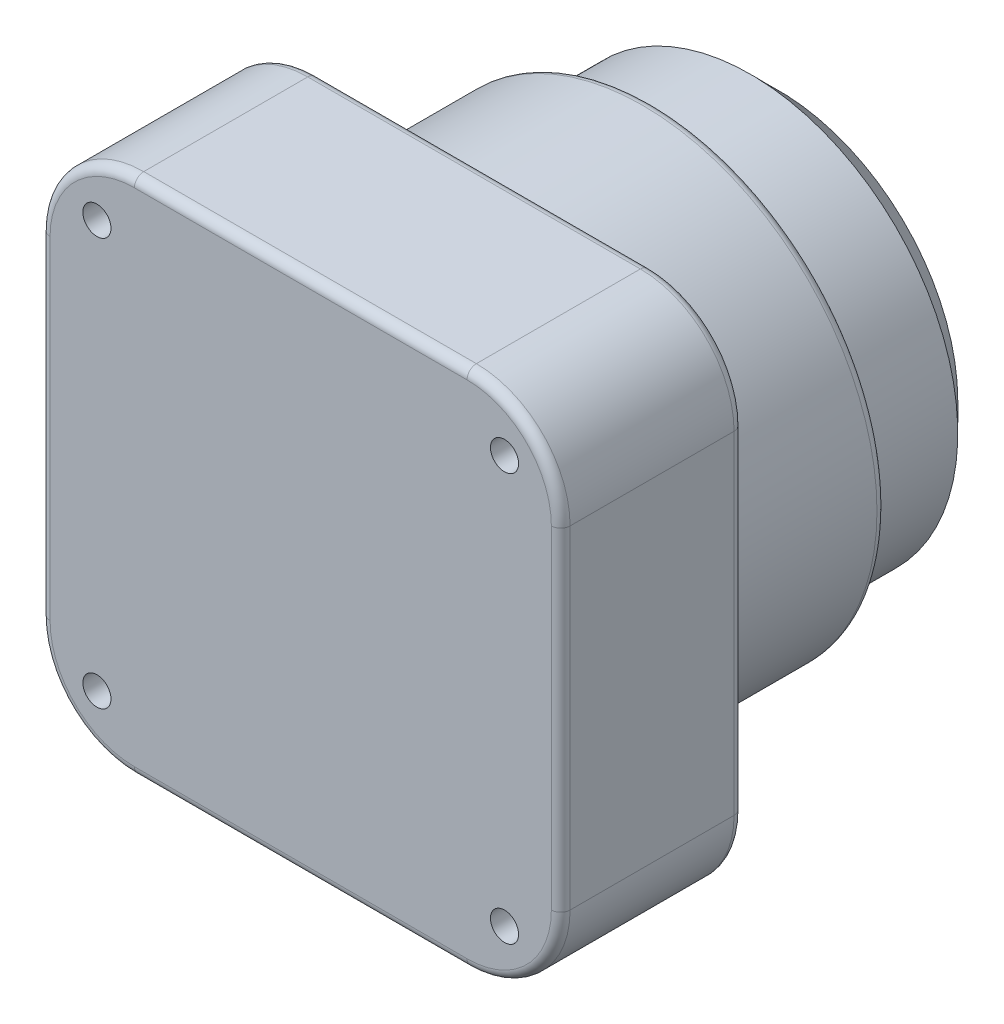
from build123d import *

# Parameters (mm, degrees)
ESQUISSE1_W             = 55.5
ESQUISSE1_H             = 55.5
BOSS_EXTRU_1_DEPTH      = 19.5
ESQUISSE2_R             = 25
BOSS_EXTRU_2_DEPTH      = 18
ESQUISSE3_R             = 22.125
BOSS_EXTRU_3_DEPTH      = 13.5
CHANFREIN1_SIZE         = 3
CONG_1_R                = 1
CONG_2_R                = 10
ESQUISSE4_R             = 1.5
ENL_V_MAT_EXTRU_1_DEPTH = 4
ESQUISSE5_W             = 14.5
ESQUISSE5_H             = 2.5
ENL_V_MAT_EXTRU_2_DEPTH = 4


with BuildPart() as part:
    # Esquisse1 → Boss.-Extru.1 (new body)
    with BuildSketch(Plane.XY):
        Rectangle(ESQUISSE1_W, ESQUISSE1_H)
    extrude(amount=BOSS_EXTRU_1_DEPTH)

    # Esquisse2 → Boss.-Extru.2 (add)
    with BuildSketch(Plane(origin=(0, 0, 0), x_dir=(-1, 0, 0), z_dir=(0, 0, -1))):
        Circle(ESQUISSE2_R)
    extrude(amount=BOSS_EXTRU_2_DEPTH)

    # Esquisse3 → Boss.-Extru.3 (add)
    with BuildSketch(Plane(origin=(0, 0, -18), x_dir=(-1, 0, 0), z_dir=(0, 0, -1))):
        Circle(ESQUISSE3_R)
    extrude(amount=BOSS_EXTRU_3_DEPTH)

    # Chanfrein1
    chanfrein1_edges = [part.edges().sort_by_distance(p)[0] for p in [
        (22.125, 0, -31.5),
    ]]
    chamfer(chanfrein1_edges, length=CHANFREIN1_SIZE)

    # Congé1
    cong_1_edges = [part.edges().sort_by_distance(p)[0] for p in [
        (27.75, 0, 19.5),
        (25, 0, 0),
        (25, 0, -18),
        (0, 27.75, 19.5),
        (22.125, 0, -18),
        (-27.75, 0, 19.5),
        (0, 27.75, 0),
        (27.75, 0, 0),
        (0, -27.75, 0),
        (-27.75, 0, 0),
        (0, -27.75, 19.5),
    ]]
    fillet(cong_1_edges, radius=CONG_1_R)

    # Congé2
    # the kernel refuses this fillet: 10 mm, written as the material it takes off along each edge
    with BuildSketch(Plane(origin=(17.75, -17.75, 19.5), x_dir=(0, -1, 0), z_dir=(-1, 0, 0))) as cong_2_piece_1:
        with BuildLine():
            CenterArc((9, -1), 1, 0, 90)
            Line((10, -1), (10, 0))
            Line((10, 0), (9, 0))
        make_face()
    revolve(axis=Axis((17.75, -17.75, 19.5), (0, 0, 1)), revolution_arc=90, mode=Mode.SUBTRACT)
    with BuildSketch(Plane(origin=(-17.75, -17.75, 19.5), x_dir=(-1, 0, 0), z_dir=(0, 1, 0))) as cong_2_piece_2:
        with BuildLine():
            CenterArc((9, -1), 1, 0, 90)
            Line((10, -1), (10, 0))
            Line((10, 0), (9, 0))
        make_face()
    revolve(axis=Axis((-17.75, -17.75, 19.5), (0, 0, 1)), revolution_arc=90, mode=Mode.SUBTRACT)
    with BuildSketch(Plane(origin=(17.75, 17.75, 19.5), x_dir=(1, 0, 0), z_dir=(0, -1, 0))) as cong_2_piece_3:
        with BuildLine():
            CenterArc((9, -1), 1, 0, 90)
            Line((10, -1), (10, 0))
            Line((10, 0), (9, 0))
        make_face()
    revolve(axis=Axis((17.75, 17.75, 19.5), (0, 0, 1)), revolution_arc=90, mode=Mode.SUBTRACT)
    with BuildSketch(Plane(origin=(-17.75, 17.75, 19.5), x_dir=(0, 1, 0), z_dir=(1, 0, 0))) as cong_2_piece_4:
        with BuildLine():
            CenterArc((9, -1), 1, 0, 90)
            Line((10, -1), (10, 0))
            Line((10, 0), (9, 0))
        make_face()
    revolve(axis=Axis((-17.75, 17.75, 19.5), (0, 0, 1)), revolution_arc=90, mode=Mode.SUBTRACT)
    with BuildSketch(Plane(origin=(17.75, 17.75, 0), x_dir=(0, 1, 0), z_dir=(-1, 0, 0))) as cong_2_piece_5:
        with BuildLine():
            CenterArc((9, -1), 1, 0, 90)
            Line((10, -1), (10, 0))
            Line((10, 0), (9, 0))
        make_face()
    revolve(axis=Axis((17.75, 17.75, 0), (0, 0, -1)), revolution_arc=90, mode=Mode.SUBTRACT)
    with BuildSketch(Plane(origin=(17.75, -17.75, 0), x_dir=(1, 0, 0), z_dir=(0, 1, 0))) as cong_2_piece_6:
        with BuildLine():
            CenterArc((9, -1), 1, 0, 90)
            Line((10, -1), (10, 0))
            Line((10, 0), (9, 0))
        make_face()
    revolve(axis=Axis((17.75, -17.75, 0), (0, 0, -1)), revolution_arc=90, mode=Mode.SUBTRACT)
    with BuildSketch(Plane(origin=(-17.75, 17.75, 0), x_dir=(-1, 0, 0), z_dir=(0, -1, 0))) as cong_2_piece_7:
        with BuildLine():
            CenterArc((9, -1), 1, 0, 90)
            Line((10, -1), (10, 0))
            Line((10, 0), (9, 0))
        make_face()
    revolve(axis=Axis((-17.75, 17.75, 0), (0, 0, -1)), revolution_arc=90, mode=Mode.SUBTRACT)
    with BuildSketch(Plane(origin=(-17.75, -17.75, 0), x_dir=(0, -1, 0), z_dir=(1, 0, 0))) as cong_2_piece_8:
        with BuildLine():
            CenterArc((9, -1), 1, 0, 90)
            Line((10, -1), (10, 0))
            Line((10, 0), (9, 0))
        make_face()
    revolve(axis=Axis((-17.75, -17.75, 0), (0, 0, -1)), revolution_arc=90, mode=Mode.SUBTRACT)
    with BuildSketch(Plane(origin=(-27.75, 27.75, 0), x_dir=(1, 0, 0), z_dir=(0, 0, 1)), Plane(origin=(-27.75, -27.75, 0), x_dir=(0, 1, 0), z_dir=(0, 0, 1))) as cong_2_piece_9:
        with BuildLine():
            CenterArc((CONG_2_R, -CONG_2_R), CONG_2_R, 90, 90)
            Line((0, -CONG_2_R), (0, 0))
            Line((0, 0), (CONG_2_R, 0))
        make_face()
    extrude(amount=19.5, mode=Mode.SUBTRACT)
    with BuildSketch(Plane(origin=(27.75, 27.75, 0), x_dir=(-1, 0, 0), z_dir=(0, 0, 1)), Plane(origin=(27.75, -27.75, 0), x_dir=(0, 1, 0), z_dir=(0, 0, 1))) as cong_2_piece_10:
        with BuildLine():
            CenterArc((CONG_2_R, CONG_2_R), CONG_2_R, 180, 90)
            Line((0, CONG_2_R), (0, 0))
            Line((0, 0), (CONG_2_R, 0))
        make_face()
    extrude(amount=19.5, mode=Mode.SUBTRACT)

    # Esquisse4 → Enlèv. mat.-Extru.1 (cut)
    with BuildSketch(Plane.XY.offset(19.5)):
        with Locations((-21.75, 21.75)):
            Circle(ESQUISSE4_R)
        with Locations((21.75, 21.75)):
            Circle(ESQUISSE4_R)
        with Locations((21.75, -21.75)):
            Circle(ESQUISSE4_R)
        with Locations((-21.75, -21.75)):
            Circle(ESQUISSE4_R)
    extrude(amount=-ENL_V_MAT_EXTRU_1_DEPTH, mode=Mode.SUBTRACT)

    # Esquisse5 → Enlèv. mat.-Extru.2 (cut)
    with BuildSketch(Plane.XZ.offset(27.75)):
        with Locations((0, 15.25)):
            Rectangle(ESQUISSE5_W, ESQUISSE5_H)
    extrude(amount=-ENL_V_MAT_EXTRU_2_DEPTH, mode=Mode.SUBTRACT)


solid = part.part
